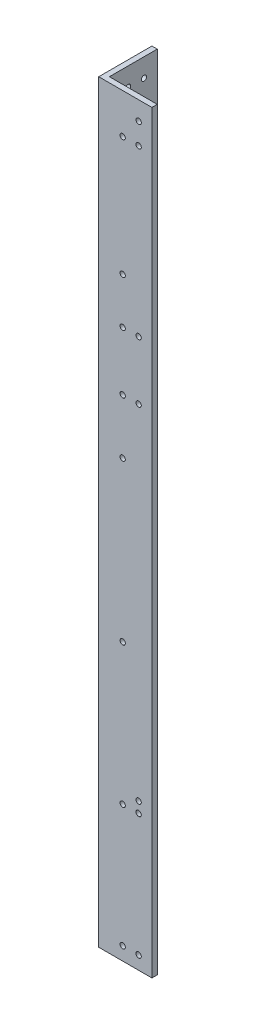
from build123d import *

# Parameters (mm, degrees)
BOSS_EXTRUDE1_DEPTH              = 450
LEFTSIDEHOLES_SKETCH3_R          = 1.5875
LEFTSIDEHOLES_CUT_EXTRUDE1_DEPTH = 3.175
BACKSIDEHOLES_SKETCH4_R          = 1.5875
BACKSIDEHOLES_CUT_EXTRUDE2_DEPTH = 3.175


with BuildPart() as part:
    # Sketch2 → Boss-Extrude1 (new body)
    with BuildSketch(Plane(origin=(0, 0, 0), x_dir=(1, 0, 0), z_dir=(0, 1, 0))):
        Polygon((0, 31.75), (3.175, 31.75), (3.175, 3.175), (31.75, 3.175), (31.75, 0), (0, 0), align=None)
    extrude(amount=BOSS_EXTRUDE1_DEPTH)

    # LeftSideHoles-Sketch3 → LeftSideHoles-Cut-Extrude1 (cut)
    with BuildSketch(Plane.XY):
        with Locations((14.2875, 81.1125)):
            Circle(LEFTSIDEHOLES_SKETCH3_R)
        with Locations((23.8125, 81.1125)):
            Circle(LEFTSIDEHOLES_SKETCH3_R)
        with Locations((23.8125, 87.4625)):
            Circle(LEFTSIDEHOLES_SKETCH3_R)
        with Locations((14.2875, 426.1875)):
            Circle(LEFTSIDEHOLES_SKETCH3_R)
        with Locations((23.8125, 438.8875)):
            Circle(LEFTSIDEHOLES_SKETCH3_R)
        with Locations((23.8125, 426.1875)):
            Circle(LEFTSIDEHOLES_SKETCH3_R)
        with Locations((14.2875, 327.602644)):
            Circle(LEFTSIDEHOLES_SKETCH3_R)
        with Locations((23.8125, 327.602644)):
            Circle(LEFTSIDEHOLES_SKETCH3_R)
        with Locations((14.2875, 292.677644)):
            Circle(LEFTSIDEHOLES_SKETCH3_R)
        with Locations((23.8125, 292.677644)):
            Circle(LEFTSIDEHOLES_SKETCH3_R)
        with Locations((14.2875, 7.9375)):
            Circle(LEFTSIDEHOLES_SKETCH3_R)
        with Locations((23.8125, 7.9375)):
            Circle(LEFTSIDEHOLES_SKETCH3_R)
        with Locations((14.2875, 165)):
            Circle(LEFTSIDEHOLES_SKETCH3_R)
        with Locations((14.2875, 260)):
            Circle(LEFTSIDEHOLES_SKETCH3_R)
        with Locations((14.2875, 355)):
            Circle(LEFTSIDEHOLES_SKETCH3_R)
    extrude(amount=-LEFTSIDEHOLES_CUT_EXTRUDE1_DEPTH, mode=Mode.SUBTRACT)

    # BackSideHoles-Sketch4 → BackSideHoles-Cut-Extrude2 (cut)
    with BuildSketch(Plane.ZY):
        with Locations((-23.8125, 81.1125)):
            Circle(BACKSIDEHOLES_SKETCH4_R)
        with Locations((-23.8125, 87.4625)):
            Circle(BACKSIDEHOLES_SKETCH4_R)
        with Locations((-14.2875, 87.4625)):
            Circle(BACKSIDEHOLES_SKETCH4_R)
        with Locations((-23.8125, 438.8875)):
            Circle(BACKSIDEHOLES_SKETCH4_R)
        with Locations((-14.2875, 438.8875)):
            Circle(BACKSIDEHOLES_SKETCH4_R)
        with Locations((-23.8125, 426.1875)):
            Circle(BACKSIDEHOLES_SKETCH4_R)
        with Locations((-23.8125, 327.602644)):
            Circle(BACKSIDEHOLES_SKETCH4_R)
        with Locations((-14.2875, 327.602644)):
            Circle(BACKSIDEHOLES_SKETCH4_R)
        with Locations((-23.8125, 321.252644)):
            Circle(BACKSIDEHOLES_SKETCH4_R)
        with Locations((-14.2875, 321.252644)):
            Circle(BACKSIDEHOLES_SKETCH4_R)
        with Locations((-14.2875, 165)):
            Circle(BACKSIDEHOLES_SKETCH4_R)
        with Locations((-14.2875, 260)):
            Circle(BACKSIDEHOLES_SKETCH4_R)
        with Locations((-14.2875, 355)):
            Circle(BACKSIDEHOLES_SKETCH4_R)
        with Locations((-23.8125, 7.9375)):
            Circle(BACKSIDEHOLES_SKETCH4_R)
        with Locations((-14.2875, 7.9375)):
            Circle(BACKSIDEHOLES_SKETCH4_R)
    extrude(amount=-BACKSIDEHOLES_CUT_EXTRUDE2_DEPTH, mode=Mode.SUBTRACT)


solid = part.part
